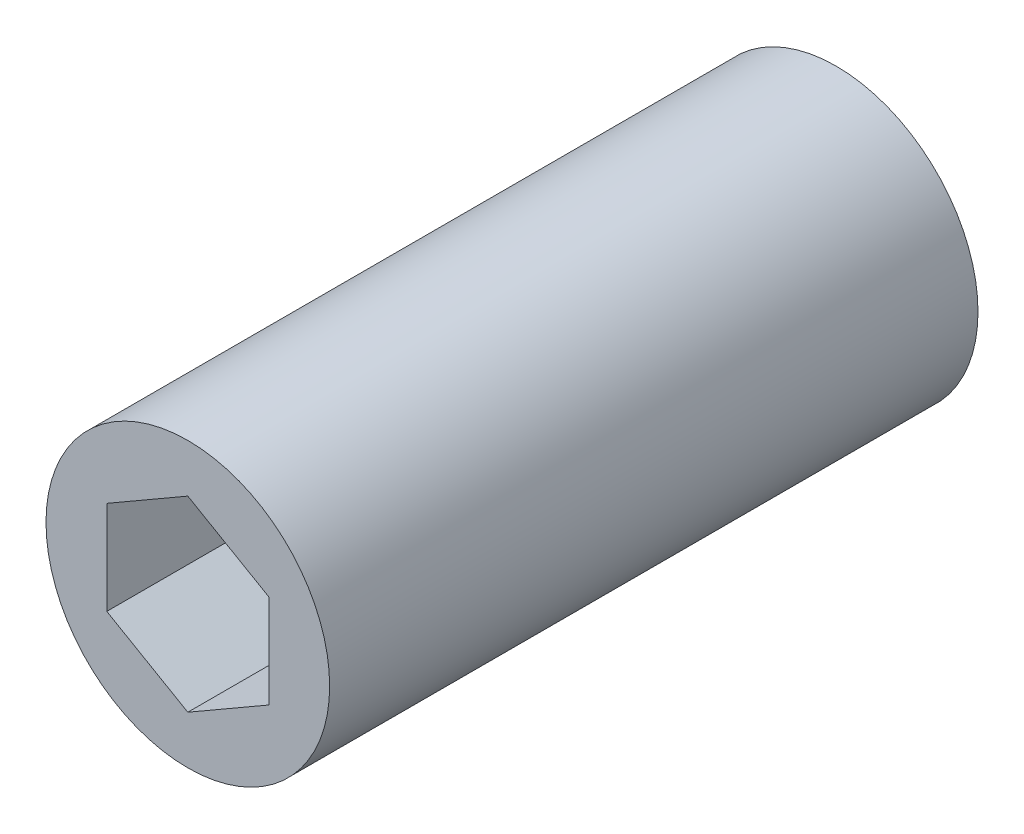
from build123d import *

# Parameters (mm, degrees)
SKETCH1_R           = 11.1125
BOSS_EXTRUDE1_DEPTH = 50.8


with BuildPart() as part:
    # Sketch1 → Boss-Extrude1 (new body)
    with BuildSketch(Plane.XY):
        Circle(SKETCH1_R)
        Polygon((0, 7.332348419), (-6.35, 3.666174209), (-6.35, -3.666174209), (0, -7.332348419), (6.35, -3.666174209), (6.35, 3.666174209), align=None, mode=Mode.SUBTRACT)
    extrude(amount=BOSS_EXTRUDE1_DEPTH)


solid = part.part
